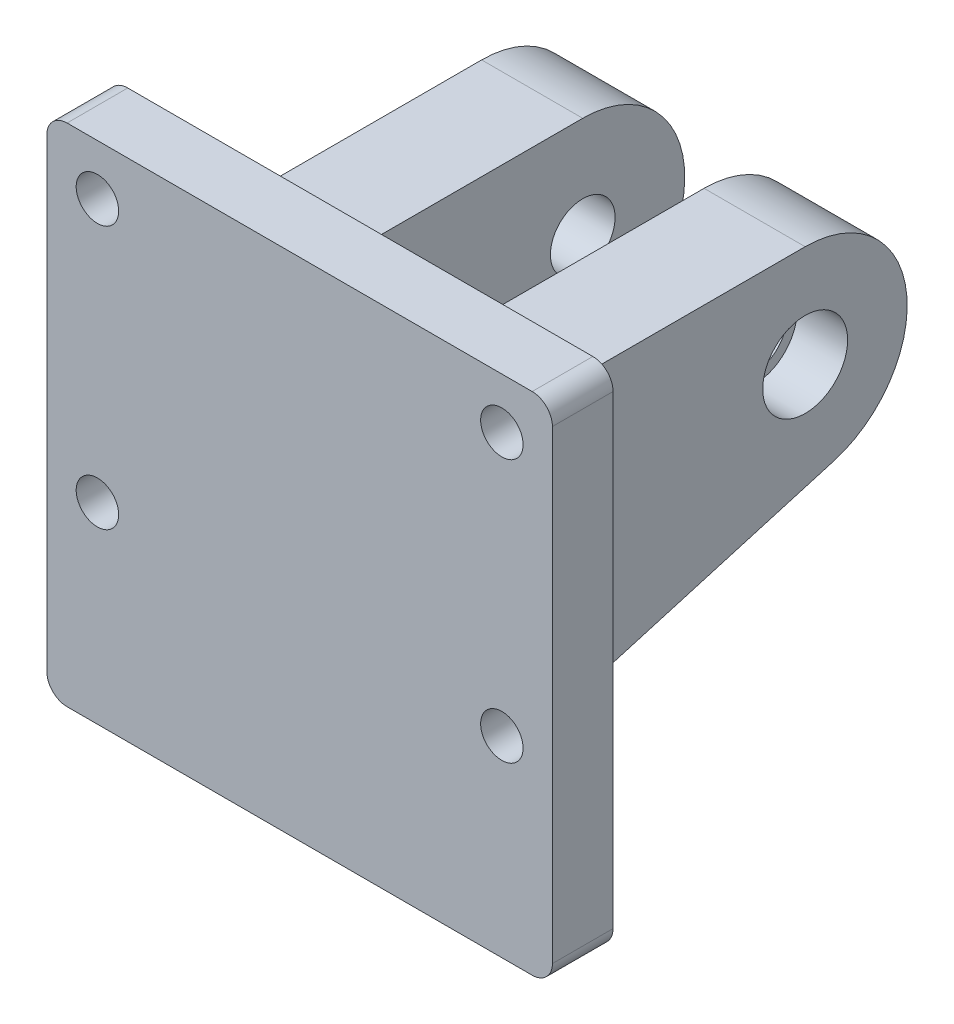
from build123d import *

# Parameters (mm, degrees)
SKETCH1_W            = 25
SKETCH1_H            = 25
BOSS_EXTRUDE1_DEPTH  = 3
SKETCH2_R            = 1.05
CUT_EXTRUDE1_DEPTH   = 18.930421077
LPATTERN1_COUNT      = 2
LPATTERN1_PITCH      = 20
LPATTERN1_COUNT_DIR2 = 2
LPATTERN1_PITCH_DIR2 = 13
BOSS_EXTRUDE2_START  = 3
SKETCH3_R            = 1.6
BOSS_EXTRUDE2_DEPTH  = 5
SKETCH4_R            = 2.1
CUT_EXTRUDE2_DEPTH   = 2.5
FILLET1_R            = 1


with BuildPart() as part:
    # Sketch1 → Boss-Extrude1 (new body)
    with BuildSketch(Plane.XY):
        Rectangle(SKETCH1_W, SKETCH1_H)
    extrude(amount=BOSS_EXTRUDE1_DEPTH)

    # Sketch2 → Cut-Extrude1 (cut, through all)
    with BuildSketch(Plane.XY.offset(3)):
        with Locations((-10, 10)):
            Circle(SKETCH2_R)
    cut_extrude1 = extrude(amount=-CUT_EXTRUDE1_DEPTH, mode=Mode.SUBTRACT)

    # LPattern1: Cut-Extrude1 2 × 2
    with Locations(*[(i * LPATTERN1_PITCH, -j * LPATTERN1_PITCH_DIR2, 0) for i in range(LPATTERN1_COUNT) for j in range(LPATTERN1_COUNT_DIR2) if (i, j) != (0, 0)]):
        add(cut_extrude1, mode=Mode.SUBTRACT)

    # Sketch3 → Boss-Extrude2 (add)
    with BuildSketch(Plane(origin=(0, 0, 0), x_dir=(0, 0, -1), z_dir=(1, 0, 0)).offset(BOSS_EXTRUDE2_START)):
        with BuildLine():
            Line((0, 8.452576065), (0, -5.923913637))
            Line((0, -5.923913637), (15.410661197, -1.435508484))
            ThreePointArc((15.410661197, -1.435508484), (18.994101047, 4.120381517), (14, 8.452576065))
            Line((14, 8.452576065), (0, 8.452576065))
        make_face()
        with Locations((14, 3.407909397)):
            Circle(SKETCH3_R, mode=Mode.SUBTRACT)
    boss_extrude2 = extrude(amount=BOSS_EXTRUDE2_DEPTH)

    # Mirror1: Boss-Extrude2 across plane
    add(boss_extrude2.mirror(Plane(origin=(0, 0, 0), x_dir=(0, 0, 1), z_dir=(1, 0, 0))))

    # Sketch4 → Cut-Extrude2 (cut)
    with BuildSketch(Plane(origin=(8, 0, 0), x_dir=(0, 0, -1), z_dir=(1, 0, 0))):
        with Locations((14, 3.407909397)):
            Circle(SKETCH4_R)
    extrude(amount=-CUT_EXTRUDE2_DEPTH, mode=Mode.SUBTRACT)

    # Fillet1
    fillet1_edges = [part.edges().sort_by_distance(p)[0] for p in [
        (12.5, -12.5, 1.5),
        (12.5, 12.5, 1.5),
        (-12.5, 12.5, 1.5),
        (-12.5, -12.5, 1.5),
        (-8, 1.264331214, 0),
        (3, 1.264331214, 0),
        (-3, 1.264331214, 0),
        (8, 1.264331214, 0),
    ]]
    fillet(fillet1_edges, radius=FILLET1_R)


solid = part.part
